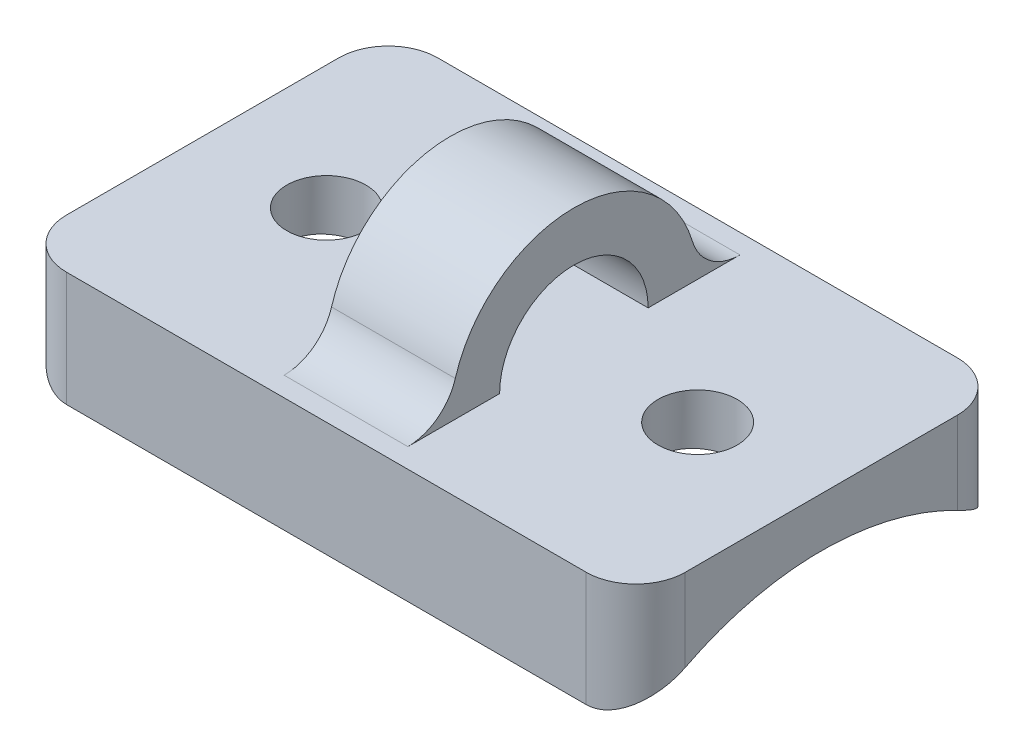
from build123d import *

# Parameters (mm, degrees)
BOSS_EXTRUDE1_DEPTH  = 12.5
BOSS_EXTRUDE2_DEPTH  = 2.5
FILLET1_R            = 2
M3_CLEARANCE_HOLE1_D = 3.2


with BuildPart() as part:
    # Sketch1 → Boss-Extrude1 (new, symmetric)
    with BuildSketch(Plane(origin=(0, 0, 0), x_dir=(0, 0, -1), z_dir=(1, 0, 0))):
        with BuildLine():
            Line((-7.5, 9.367496998), (-7.5, 14))
            Line((-7.5, 14), (7.5, 14))
            Line((7.5, 14), (7.5, 9.367496998))
            ThreePointArc((7.5, 9.367496998), (0, 12), (-7.5, 9.367496998))
        make_face()
    extrude(amount=BOSS_EXTRUDE1_DEPTH, both=True)

    # Sketch2 → Boss-Extrude2 (add, symmetric)
    with BuildSketch(Plane(origin=(0, 0, 0), x_dir=(0, 0, -1), z_dir=(1, 0, 0))):
        with BuildLine():
            Line((-5, 14), (-3, 14))
            ThreePointArc((-3, 14), (0, 17), (3, 14))
            Line((3, 14), (5, 14))
            ThreePointArc((5, 14), (0, 19), (-5, 14))
        make_face()
    extrude(amount=BOSS_EXTRUDE2_DEPTH, both=True)

    # Fillet1
    fillet1_edges = [part.edges().sort_by_distance(p)[0] for p in [
        (0, 14, -5),
        (0, 14, 5),
    ]]
    fillet(fillet1_edges, radius=FILLET1_R)
    fillet1_2_edges = [part.edges().sort_by_distance(p)[0] for p in [
        (12.5, 11.683748499, -7.5),
        (-12.5, 11.683748499, -7.5),
        (-12.5, 11.683748499, 7.5),
        (12.5, 11.683748499, 7.5),
    ]]
    fillet(fillet1_2_edges, radius=FILLET1_R)

    # M3 Clearance Hole1 (through all)
    with Locations(Plane(origin=(0, 14, 0), x_dir=(1, 0, 0), z_dir=(0, 1, 0))):
        with Locations((-7.5, 0), (7.5, 0)):
            Hole(M3_CLEARANCE_HOLE1_D / 2)


solid = part.part
